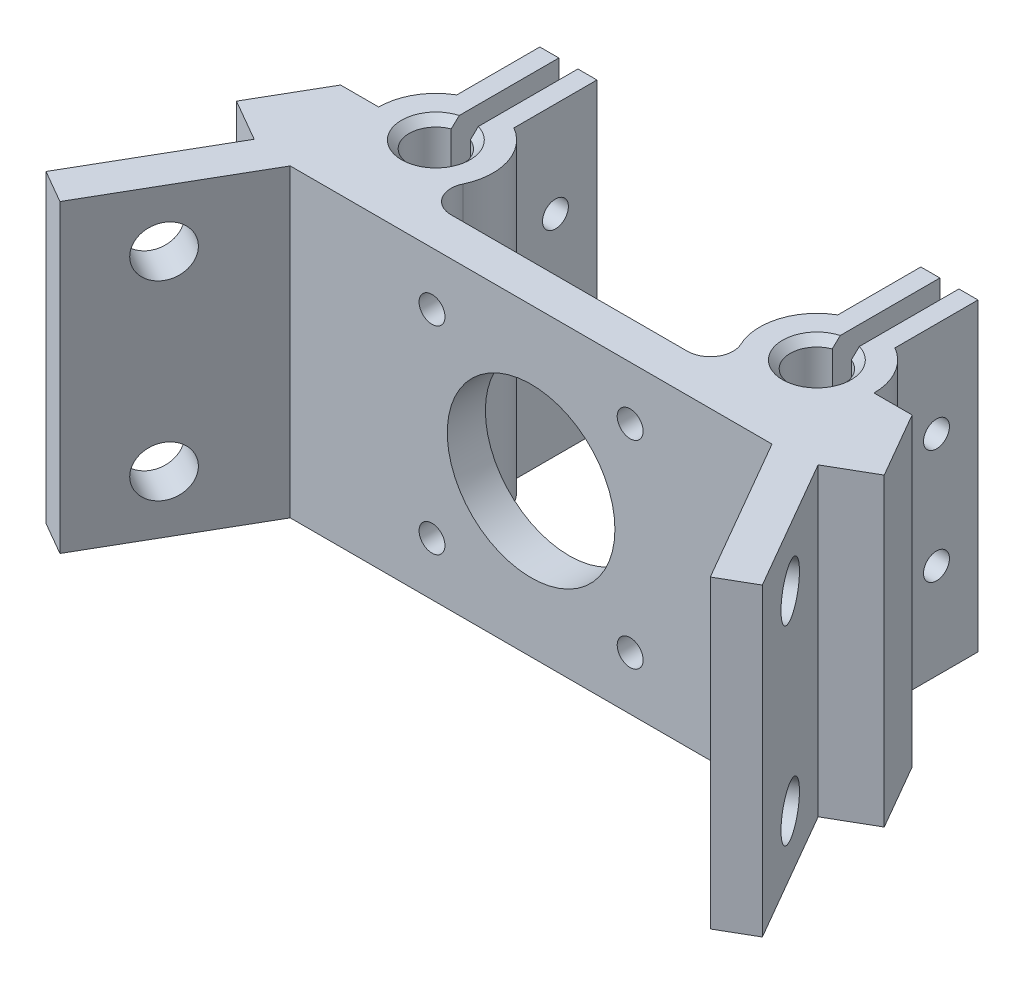
from build123d import *

# Parameters (mm, degrees)
BOSS_EXTRUDE1_DEPTH = 40
SKETCH2_R           = 1.7
CUT_EXTRUDE1_DEPTH  = 28.75
SKETCH4_R           = 1.7
SKETCH4_R_2         = 11
CUT_EXTRUDE2_DEPTH  = 20
CHAMFER1_SIZE       = 1
CUT_EXTRUDE3_REACH  = 151.38
SKETCH5_R           = 3.3


with BuildPart() as part:
    # Sketch1 → Boss-Extrude1 (new body)
    with BuildSketch(Plane(origin=(0, 0, 0), x_dir=(1, 0, 0), z_dir=(0, 1, 0))):
        with BuildLine():
            ThreePointArc((26.25, 110.769174208), (25, 104), (23.75, 110.769174208))
            Line((23.75, 110.769174208), (23.75, 124.895099729))
            Line((23.75, 124.895099729), (21.25, 124.895099729))
            Line((21.25, 124.895099729), (21.25, 113.995190528))
            ThreePointArc((21.25, 113.995190528), (17.839743095, 109.73175291), (18.223690728, 104.285714286))
            ThreePointArc((18.223690728, 104.285714286), (18.048629784, 101.396432549), (15.513167019, 100))
            Line((15.513167019, 100), (-15.513167019, 100))
            ThreePointArc((-15.513167019, 100), (-18.048629784, 101.396432549), (-18.223690728, 104.285714286))
            ThreePointArc((-18.223690728, 104.285714286), (-17.839743095, 109.73175291), (-21.25, 113.995190528))
            Line((-21.25, 113.995190528), (-21.25, 124.895099729))
            Line((-21.25, 124.895099729), (-23.75, 124.895099729))
            Line((-23.75, 124.895099729), (-23.75, 110.769174208))
            ThreePointArc((-23.75, 110.769174208), (-25, 104), (-26.25, 110.769174208))
            Line((-26.25, 110.769174208), (-26.25, 124.895099729))
            Line((-26.25, 124.895099729), (-28.75, 124.895099729))
            Line((-28.75, 124.895099729), (-28.75, 113.995190528))
            ThreePointArc((-28.75, 113.995190528), (-31.495190528, 111.25), (-32.5, 107.5))
            Line((-32.5, 107.5), (-37.5, 107.5))
            Line((-37.5, 107.5), (-42.5, 98.839745962))
            Line((-42.5, 98.839745962), (-37.000738686, 95.664745962))
            Line((-37.000738686, 95.664745962), (-47.000738686, 78.344237886))
            Line((-47.000738686, 78.344237886), (-42.670611667, 75.844237886))
            Line((-42.670611667, 75.844237886), (-31.611027254, 95))
            Line((-31.611027254, 95), (31.611027254, 95))
            Line((31.611027254, 95), (42.670611667, 75.844237886))
            Line((42.670611667, 75.844237886), (47.000738686, 78.344237886))
            Line((47.000738686, 78.344237886), (37.000738686, 95.664745962))
            Line((37.000738686, 95.664745962), (42.5, 98.839745962))
            Line((42.5, 98.839745962), (37.5, 107.5))
            Line((37.5, 107.5), (32.5, 107.5))
            ThreePointArc((32.5, 107.5), (31.495190528, 111.25), (28.75, 113.995190528))
            Line((28.75, 113.995190528), (28.75, 124.895099729))
            Line((28.75, 124.895099729), (26.25, 124.895099729))
            Line((26.25, 124.895099729), (26.25, 110.769174208))
        make_face()
    extrude(amount=BOSS_EXTRUDE1_DEPTH)

    # Sketch2 → Cut-Extrude1 (cut, symmetric)
    with BuildSketch(Plane(origin=(0, 0, 0), x_dir=(0, 0, -1), z_dir=(1, 0, 0))):
        with Locations((119.445145129, 27.5)):
            Circle(SKETCH2_R)
        with Locations((119.445145129, 12.5)):
            Circle(SKETCH2_R)
    extrude(amount=CUT_EXTRUDE1_DEPTH, both=True, mode=Mode.SUBTRACT)

    # Sketch4 → Cut-Extrude2 (cut)
    with BuildSketch(Plane.XY.offset(-95)):
        with Locations((-13, 33)):
            Circle(SKETCH4_R)
        with Locations((13, 33)):
            Circle(SKETCH4_R)
        with Locations((13, 7)):
            Circle(SKETCH4_R)
        with Locations((-13, 7)):
            Circle(SKETCH4_R)
        with Locations((0, 20)):
            Circle(SKETCH4_R_2)
    extrude(amount=-CUT_EXTRUDE2_DEPTH, mode=Mode.SUBTRACT)

    # Chamfer1
    chamfer1_edges = [part.edges().sort_by_distance(p)[0] for p in [
        (25, 40, -104),
        (-25, 40, -104),
    ]]
    chamfer(chamfer1_edges, length=CHAMFER1_SIZE)

    # Sketch5 → Cut-Extrude3 (cut, up to next)
    with BuildSketch(Plane(origin=(-69.174604139, 0, -39.937976321), x_dir=(-0.49999999999998673, 0, 0.8660254037844464), z_dir=(-0.8660254037844464, 0, -0.49999999999998673)), mode=Mode.PRIVATE) as cut_extrude3_sk1:
        with Locations((-54.347730907, 32.5)):
            Circle(SKETCH5_R)
    cut_extrude3_tool1 = extrude(cut_extrude3_sk1.sketch, amount=-CUT_EXTRUDE3_REACH, mode=Mode.PRIVATE) & part.part
    # Sketch5 → Cut-Extrude3 (cut, up to next)
    with BuildSketch(Plane(origin=(-69.174604139, 0, -39.937976321), x_dir=(-0.49999999999998673, 0, 0.8660254037844464), z_dir=(-0.8660254037844464, 0, -0.49999999999998673)), mode=Mode.PRIVATE) as cut_extrude3_sk2:
        with Locations((-54.347730907, 7.5)):
            Circle(SKETCH5_R)
    cut_extrude3_tool2 = extrude(cut_extrude3_sk2.sketch, amount=-CUT_EXTRUDE3_REACH, mode=Mode.PRIVATE) & part.part
    cut_extrude3_1 = cut_extrude3_tool1.solids().sort_by_distance((-42.000739, 32.5, -87.004492))[0]
    add(cut_extrude3_1, mode=Mode.SUBTRACT)
    cut_extrude3_2 = cut_extrude3_tool2.solids().sort_by_distance((-42.000739, 7.5, -87.004492))[0]
    add(cut_extrude3_2, mode=Mode.SUBTRACT)
    cut_extrude3 = cut_extrude3_1 + cut_extrude3_2  # Cut-Extrude3 as one shape, for the pattern or mirror that repeats it

    # Mirror1: Cut-Extrude3 across plane
    add(cut_extrude3.mirror(Plane(origin=(0, 0, 0), x_dir=(0, 0, 1), z_dir=(1, 0, 0))), mode=Mode.SUBTRACT)


solid = part.part
